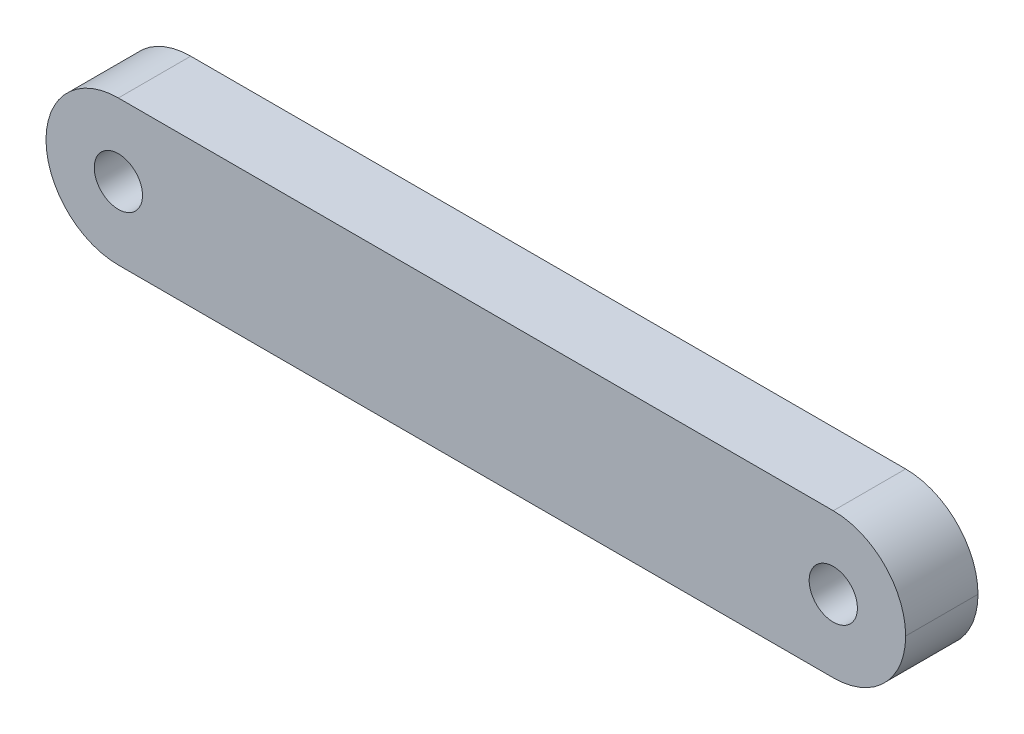
from build123d import *

# Parameters (mm, degrees)
SKETCH1_W           = 35.64
SKETCH1_H           = 6
SKETCH1_R           = 1
BOSS_EXTRUDE1_DEPTH = 3
FILLET1_R           = 3


with BuildPart() as part:
    # Sketch1 → Boss-Extrude1 (new body)
    with BuildSketch(Plane.XY):
        with Locations((17.82, 3)):
            Rectangle(SKETCH1_W, SKETCH1_H)
        with Locations((3, 3)):
            Circle(SKETCH1_R, mode=Mode.SUBTRACT)
        with Locations((32.64, 3)):
            Circle(SKETCH1_R, mode=Mode.SUBTRACT)
    extrude(amount=BOSS_EXTRUDE1_DEPTH)

    # Fillet1
    fillet1_edges = [part.edges().sort_by_distance(p)[0] for p in [
        (35.64, 0, 1.5),
        (35.64, 6, 1.5),
        (0, 0, 1.5),
        (0, 6, 1.5),
    ]]
    fillet(fillet1_edges, radius=FILLET1_R - 0.0001)  # a hair under: the kernel refuses the full size


solid = part.part
